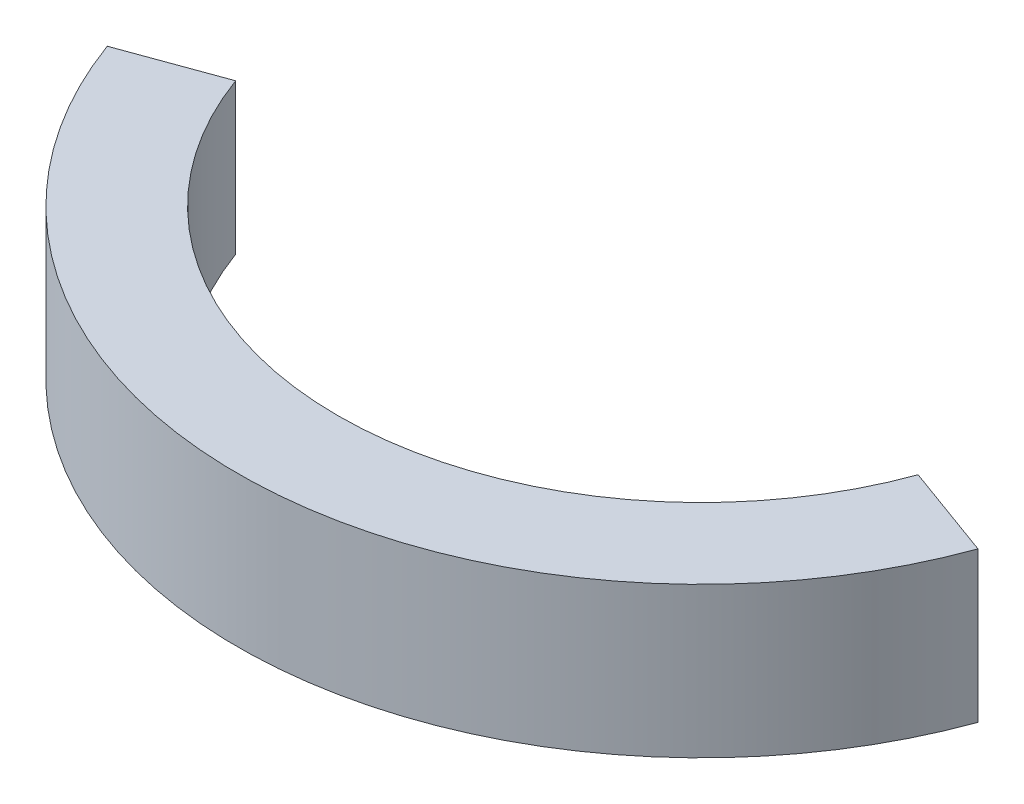
from build123d import *

# Parameters (mm, degrees)
BOSS_EXTRUDE1_DEPTH = 38.1


with BuildPart() as part:
    # Sketch1 → Boss-Extrude1 (new body)
    with BuildSketch(Plane(origin=(0, 0, 0), x_dir=(1, 0, 0), z_dir=(0, 1, 0))):
        with BuildLine():
            Line((-110.390390627, -40.178816337), (-86.522198059, -31.491504697))
            ThreePointArc((-86.522198059, -31.491504697), (0, -92.075), (86.522198059, -31.491504697))
            Line((86.522198059, -31.491504697), (110.390390627, -40.178816337))
            ThreePointArc((110.390390627, -40.178816337), (0, -117.475), (-110.390390627, -40.178816337))
        make_face()
    extrude(amount=-BOSS_EXTRUDE1_DEPTH)


solid = part.part
